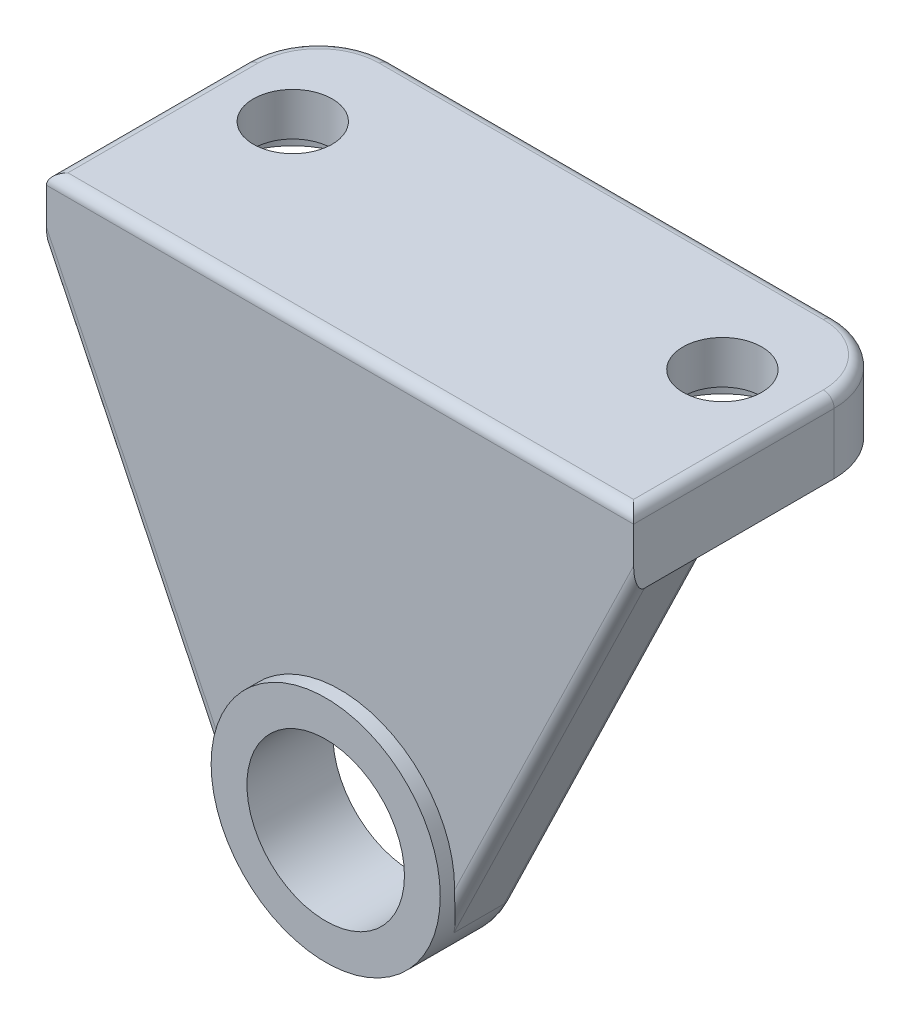
from build123d import *

# Parameters (mm, degrees)
BASE_EXTRUDE_DEPTH      = 38
CUT_EXTRUDE1_DEPTH      = 81.554329493
CUT_EXTRUDE1_DEPTH_BACK = 41
HOLE2_OUTLINE_R         = 11
HOLE2_DEPTH             = 2
HOLE2_START             = -10
HOLE2_2_OUTLINE_R       = 11
HOLE2_2_DEPTH           = 10
HOLE2_START_2           = 48
HOLE2_3_OUTLINE_R       = 10
HOLE2_3_DEPTH           = 4
HOLE2_START_3           = 52
HOLE2_4_OUTLINE_R       = 5.5
HOLE2_4_DEPTH           = 6
FILLET1_R               = 10
FILLET7_R               = 1.5


with BuildPart() as part:
    # Sketch2 → Base-Extrude (new body)
    with BuildSketch(Plane.XY):
        with BuildLine():
            Line((-14.402593128, -6.96888163), (-41, 48))
            Line((-41, 48), (-41, 58))
            Line((-41, 58), (41, 58))
            Line((41, 58), (41, 48))
            Line((41, 48), (14.402593128, -6.96888163))
            ThreePointArc((14.402593128, -6.96888163), (0, -16), (-14.402593128, -6.96888163))
        make_face()
    extrude(amount=-BASE_EXTRUDE_DEPTH)

    # Sketch3 → Cut-Extrude1 (cut, two sides: drawn at the far end of the back side and taken through both)
    with BuildSketch(Plane(origin=(0, 0, 0), x_dir=(0, 0, -1), z_dir=(1, 0, 0)).offset(-CUT_EXTRUDE1_DEPTH_BACK)):
        Polygon((10, -250.492798217), (10, -38.853504021), (10, 48), (38, 48), (249.639294197, 48), (579.708021452, -216.989431263), (340.068727255, -515.482229481), align=None)
    extrude(amount=CUT_EXTRUDE1_DEPTH + CUT_EXTRUDE1_DEPTH_BACK, mode=Mode.SUBTRACT)

    # Hole2: read off the stored shape, not the designer's step
    # Hole2 outline → Hole2 (add)
    with BuildSketch(Plane.XY):
        with BuildLine():
            ThreePointArc((14.402593128, -6.96888163), (0, 16), (-14.402593128, -6.96888163))
            ThreePointArc((-14.402593128, -6.96888163), (0, -16), (14.402593128, -6.96888163))
        make_face()
        Circle(HOLE2_OUTLINE_R, mode=Mode.SUBTRACT)
    hole2 = extrude(amount=HOLE2_DEPTH)

    # Hole2 2 outline → Hole2 2 (cut)
    with BuildSketch(Plane.XY.offset(HOLE2_START)):
        Circle(HOLE2_2_OUTLINE_R)
    hole2_2 = extrude(amount=HOLE2_2_DEPTH, mode=Mode.SUBTRACT)

    # Hole2 3 outline → Hole2 3 (cut)
    with BuildSketch(Plane(origin=(0, 0, 0), x_dir=(1, 0, 0), z_dir=(0, 1, 0)).offset(HOLE2_START_2)):
        with Locations((30, 23.4)):
            Circle(HOLE2_3_OUTLINE_R)
    hole2_3 = extrude(amount=HOLE2_3_DEPTH, mode=Mode.SUBTRACT)

    # Hole2 4 outline → Hole2 4 (cut)
    with BuildSketch(Plane(origin=(0, 0, 0), x_dir=(1, 0, 0), z_dir=(0, 1, 0)).offset(HOLE2_START_3)):
        with Locations((30, 23.4)):
            Circle(HOLE2_4_OUTLINE_R)
    hole2_4 = extrude(amount=HOLE2_4_DEPTH, mode=Mode.SUBTRACT)

    # Mirror1: Hole2, Hole2 2, Hole2 3, Hole2 4 across plane
    add(hole2.mirror(Plane(origin=(0, 0, 0), x_dir=(0, 0, 1), z_dir=(1, 0, 0))))
    add(hole2_2.mirror(Plane(origin=(0, 0, 0), x_dir=(0, 0, 1), z_dir=(1, 0, 0))), mode=Mode.SUBTRACT)
    add(hole2_3.mirror(Plane(origin=(0, 0, 0), x_dir=(0, 0, 1), z_dir=(1, 0, 0))), mode=Mode.SUBTRACT)
    add(hole2_4.mirror(Plane(origin=(0, 0, 0), x_dir=(0, 0, 1), z_dir=(1, 0, 0))), mode=Mode.SUBTRACT)

    # Fillet1
    fillet1_edges = [part.edges().sort_by_distance(p)[0] for p in [
        (41, 53, -38),
        (-41, 53, -38),
    ]]
    fillet(fillet1_edges, radius=FILLET1_R)

    # Fillet7
    # the kernel refuses this fillet: 1.5 mm, written as the material it takes off along each edge
    with BuildSketch(Plane(origin=(14.402593128, -6.96888163, -10), x_dir=(-0.9001620705215131, 0.43555510190379193, 0), z_dir=(0.435555101903792, 0.9001620705215131, 0))) as fillet7_piece_1_section:
        with BuildLine():
            CenterArc((FILLET7_R, FILLET7_R), FILLET7_R, 180, 90)
            Line((0, FILLET7_R), (0, 0))
            Line((0, 0), (FILLET7_R, 0))
        make_face()
    fillet7_piece_1 = extrude(amount=64.815538563, mode=Mode.PRIVATE)
    fillet7_piece_1 = split(fillet7_piece_1, bisect_by=Plane(origin=(14.402593128, 48, -10), z_dir=(0, -1, 0)), keep=Keep.TOP, mode=Mode.PRIVATE)
    add(fillet7_piece_1, mode=Mode.SUBTRACT)
    with BuildSketch(Plane(origin=(0, 0, -10), x_dir=(-0.9001620705215129, -0.4355551019037922, 0), z_dir=(-0.4355551019037922, 0.9001620705215129, 0))) as fillet7_piece_2:
        with BuildLine():
            CenterArc((16 - FILLET7_R, FILLET7_R), FILLET7_R, 270, 90)
            Line((16, FILLET7_R), (16, 0))
            Line((16, 0), (16 - FILLET7_R, 0))
        make_face()
    revolve(axis=Axis((0, 0, -10), (0, 0, 1)), revolution_arc=128.358757734, mode=Mode.SUBTRACT)
    with BuildSketch(Plane(origin=(-42.633331632, 51.375607764, -10), x_dir=(0, 0, 1), z_dir=(0.4355551019037922, -0.900162070521513, 0))) as fillet7_piece_3_section:
        with BuildLine():
            CenterArc((FILLET7_R, -FILLET7_R), FILLET7_R, 90, 90)
            Line((0, -FILLET7_R), (0, 0))
            Line((0, 0), (FILLET7_R, 0))
        make_face()
    fillet7_piece_3 = extrude(amount=64.815538563, mode=Mode.PRIVATE)
    fillet7_piece_3 = split(fillet7_piece_3, bisect_by=Plane(origin=(-42.633331632, 48, -10), z_dir=(0, -1, 0)), keep=Keep.TOP, mode=Mode.PRIVATE)
    add(fillet7_piece_3, mode=Mode.SUBTRACT)
    with BuildSketch(Plane(origin=(-31, 58, -38), x_dir=(0, 0, 1), z_dir=(1, 0, 0))) as fillet7_piece_4:
        with BuildLine():
            CenterArc((FILLET7_R, FILLET7_R), FILLET7_R, 180, 90)
            Line((0, FILLET7_R), (0, 0))
            Line((0, 0), (FILLET7_R, 0))
        make_face()
    extrude(amount=62, mode=Mode.SUBTRACT)
    with BuildSketch(Plane(origin=(41, 58, 3.75), x_dir=(-1, 0, 0), z_dir=(0, 0, -1)), Plane(origin=(-41, 58, 3.75), x_dir=(0, -1, 0), z_dir=(0, 0, -1))) as fillet7_piece_5:
        with BuildLine():
            CenterArc((FILLET7_R, -FILLET7_R), FILLET7_R, 90, 90)
            Line((0, -FILLET7_R), (0, 0))
            Line((0, 0), (FILLET7_R, 0))
        make_face()
    extrude(amount=31.75, mode=Mode.SUBTRACT)
    with BuildSketch(Plane(origin=(31, 58, -28), x_dir=(1, 0, 0), z_dir=(0, 0, 1))) as fillet7_piece_6:
        with BuildLine():
            CenterArc((10 - FILLET7_R, -FILLET7_R), FILLET7_R, 360, 90)
            Line((10, -FILLET7_R), (10, 0))
            Line((10, 0), (10 - FILLET7_R, 0))
        make_face()
    revolve(axis=Axis((31, 58, -28), (0, 1, 0)), revolution_arc=90, mode=Mode.SUBTRACT)
    with BuildSketch(Plane(origin=(-31, 58, -28), x_dir=(-1, 0, 0), z_dir=(0, 0, 1))) as fillet7_piece_7:
        with BuildLine():
            CenterArc((10 - FILLET7_R, FILLET7_R), FILLET7_R, 270, 90)
            Line((10 - FILLET7_R, 0), (10, 0))
            Line((10, 0), (10, FILLET7_R))
        make_face()
    revolve(axis=Axis((-31, 58, -28), (0, -1, 0)), revolution_arc=90, mode=Mode.SUBTRACT)
    with BuildSketch(Plane(origin=(-9.502598232, -17.095704924, 0), x_dir=(0, 0, -1), z_dir=(-0.4355551019037922, 0.900162070521513, 0))) as fillet7_piece_8_section:
        with BuildLine():
            CenterArc((FILLET7_R, -FILLET7_R), FILLET7_R, 90, 90)
            Line((0, -FILLET7_R), (0, 0))
            Line((0, 0), (FILLET7_R, 0))
        make_face()
    fillet7_piece_8 = extrude(amount=76.065538563, mode=Mode.PRIVATE)
    fillet7_piece_8 = fillet7_piece_8 - Plane(origin=(0, 0, 0), x_dir=(0.9001620705200065, -0.4355551019069058, 0), z_dir=(0, 0, -1)) * Cylinder(16, 159, mode=Mode.PRIVATE)
    add(fillet7_piece_8, mode=Mode.SUBTRACT)
    with BuildSketch(Plane(origin=(-44.75, 58, 0), x_dir=(0, 0, -1), z_dir=(1, 0, 0))) as fillet7_piece_9:
        with BuildLine():
            CenterArc((FILLET7_R, -FILLET7_R), FILLET7_R, 90, 90)
            Line((0, -FILLET7_R), (0, 0))
            Line((0, 0), (FILLET7_R, 0))
        make_face()
    extrude(amount=89.5, mode=Mode.SUBTRACT)
    with BuildSketch(Plane(origin=(42.633331632, 51.375607764, 0), x_dir=(-0.900162070521513, 0.4355551019037919, 0), z_dir=(-0.435555101903792, -0.9001620705215131, 0))) as fillet7_piece_10_section:
        with BuildLine():
            CenterArc((FILLET7_R, FILLET7_R), FILLET7_R, 180, 90)
            Line((0, FILLET7_R), (0, 0))
            Line((0, 0), (FILLET7_R, 0))
        make_face()
    fillet7_piece_10 = extrude(amount=76.065538563, mode=Mode.PRIVATE)
    fillet7_piece_10 = fillet7_piece_10 - Plane(origin=(0, 0, 0), x_dir=(0.9001620705200065, -0.4355551019069058, 0), z_dir=(0, 0, -1)) * Cylinder(16, 159, mode=Mode.PRIVATE)
    add(fillet7_piece_10, mode=Mode.SUBTRACT)


solid = part.part
